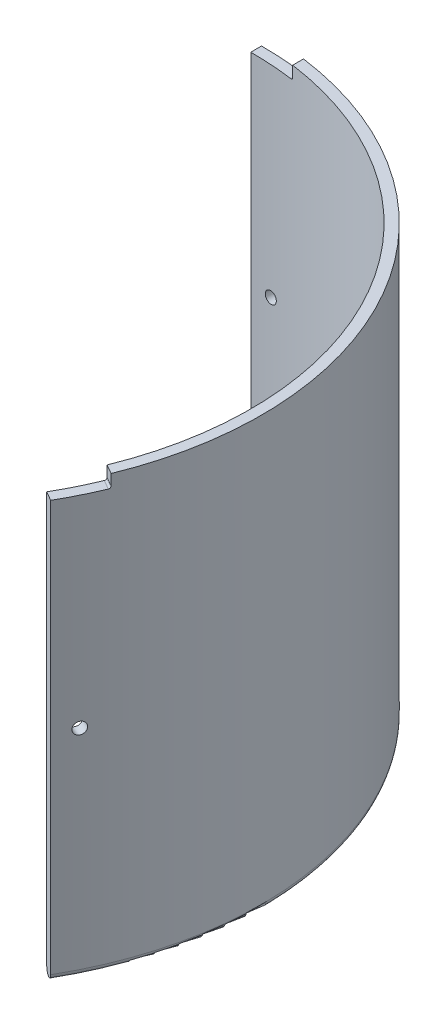
from build123d import *

# Parameters (mm, degrees)
BOSS_EXTRUDE1_DEPTH            = 200
CUT_EXTRUDE1_START             = -6
CUT_EXTRUDE1_DEPTH             = 6
FILLET1_R                      = 1
FILLET2_R                      = 2.5
M5_CLEARANCE_HOLE1_D           = 5.5
M5_CLEARANCE_HOLE1_ON_FACE_2_D = 5.5


with BuildPart() as part:
    # Sketch1 → Boss-Extrude1 (new body)
    with BuildSketch(Plane(origin=(0, 0, 0), x_dir=(1, 0, 0), z_dir=(0, 1, 0))):
        with BuildLine():
            Line((0, 150), (0, 155))
            ThreePointArc((0, 155), (134.233937587, 77.5), (134.233937587, -77.5))
            Line((134.233937587, -77.5), (129.903810568, -75))
            ThreePointArc((129.903810568, -75), (129.903810568, 75), (0, 150))
        make_face()
    extrude(amount=BOSS_EXTRUDE1_DEPTH)

    # Sketch3 → Cut-Extrude1 (cut)
    with BuildSketch(Plane(origin=(0, 200, 0), x_dir=(1, 0, 0), z_dir=(0, 1, 0)).offset(CUT_EXTRUDE1_START)):
        with BuildLine():
            Line((21, 153.570830564), (21, 148.522725534))
            ThreePointArc((21, 148.522725534), (10.525948174, 149.630225606), (0, 150))
            Line((0, 150), (0, 155))
            ThreePointArc((0, 155), (10.524287687, 154.642294889), (21, 153.570830564))
        make_face()
        with BuildLine():
            Line((143.496240548, -58.598881802), (139.124453352, -56.074829287))
            ThreePointArc((139.124453352, -56.074829287), (134.846550636, -65.699374286), (129.903810568, -75))
            Line((129.903810568, -75), (134.233937587, -77.5))
            ThreePointArc((134.233937587, -77.5), (139.186299717, -68.206846951), (143.496240548, -58.598881802))
        make_face()
    extrude(amount=CUT_EXTRUDE1_DEPTH, mode=Mode.SUBTRACT)

    # Fillet1
    fillet1_edges = [part.edges().sort_by_distance(p)[0] for p in [
        (21, 194, -151.046778049),
        (141.31034695, 194, 57.336855545),
    ]]
    fillet(fillet1_edges, radius=FILLET1_R)

    # Fillet2
    fillet2_edges = [part.edges().sort_by_distance(p)[0] for p in [
        (134.233937587, 0, -77.5),
        (129.903810568, 0, -75),
    ]]
    fillet(fillet2_edges, radius=FILLET2_R - 0.0001)  # a hair under: the kernel refuses the full size

    # M5 Clearance Hole1 (through all)
    with Locations(Plane(origin=(138.954283246, 100, 68.678287453), x_dir=(-0.443085725506, 0, 0.89647924675), z_dir=(0.89647924675, 0, 0.443085725506))):
        with Locations((0, 0)):
            Hole(M5_CLEARANCE_HOLE1_D / 2)

    # M5 Clearance Hole1 on face 2 (through all)
    with Locations(Plane(origin=(10, 100, -154.677082983), x_dir=(-0.997916674108, 0, -0.064515978931), z_dir=(0.064515978931, 0, -0.997916674108))):
        with Locations((0, 0)):
            Hole(M5_CLEARANCE_HOLE1_ON_FACE_2_D / 2)


solid = part.part
